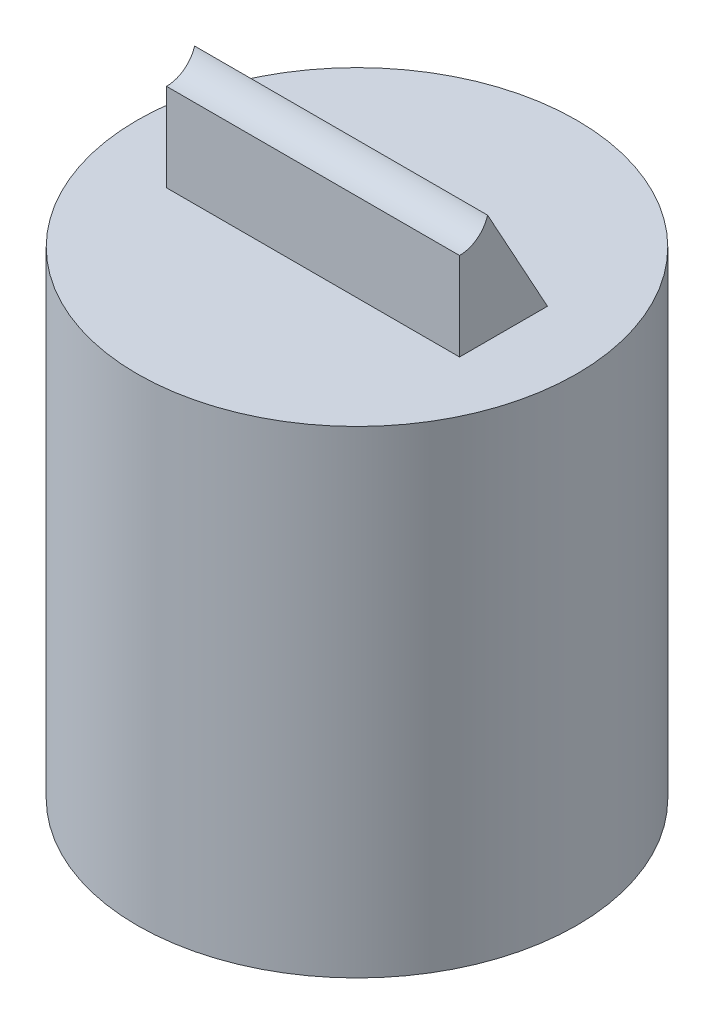
from build123d import *

# Parameters (mm, degrees)
SKIZZE1_R                       = 75
AUFSATZ_LINEAR_AUSTRAGEN1_DEPTH = 163
SKIZZE2_W                       = 100
SKIZZE2_H                       = 30
AUFSATZ_LINEAR_AUSTRAGEN2_DEPTH = 40
SKIZZE3_R                       = 10
SCHNITT_LINEAR_AUSTRAGEN2_DEPTH = 100
SCHNITT_LINEAR_AUSTRAGEN3_DEPTH = 100


with BuildPart() as part:
    # Skizze1 → Aufsatz-Linear austragen1 (new body)
    with BuildSketch(Plane(origin=(0, 0, 0), x_dir=(1, 0, 0), z_dir=(0, 1, 0))):
        Circle(SKIZZE1_R)
    extrude(amount=AUFSATZ_LINEAR_AUSTRAGEN1_DEPTH)

    # Skizze2 → Aufsatz-Linear austragen2 (add)
    with BuildSketch(Plane(origin=(0, 163, 0), x_dir=(1, 0, 0), z_dir=(0, 1, 0))):
        Rectangle(SKIZZE2_W, SKIZZE2_H)
    extrude(amount=AUFSATZ_LINEAR_AUSTRAGEN2_DEPTH)

    # Skizze3 → Schnitt-Linear austragen2 (cut)
    with BuildSketch(Plane(origin=(50, 0, 0), x_dir=(0, 0, -1), z_dir=(1, 0, 0))):
        with Locations((-15, 203)):
            Circle(SKIZZE3_R)
    extrude(amount=-SCHNITT_LINEAR_AUSTRAGEN2_DEPTH, mode=Mode.SUBTRACT)

    # Skizze4 → Schnitt-Linear austragen3 (cut)
    with BuildSketch(Plane(origin=(50, 0, 0), x_dir=(0, 0, -1), z_dir=(1, 0, 0))):
        Polygon((15, 163), (15, 203), (-7, 203), align=None)
    extrude(amount=-SCHNITT_LINEAR_AUSTRAGEN3_DEPTH, mode=Mode.SUBTRACT)


solid = part.part
